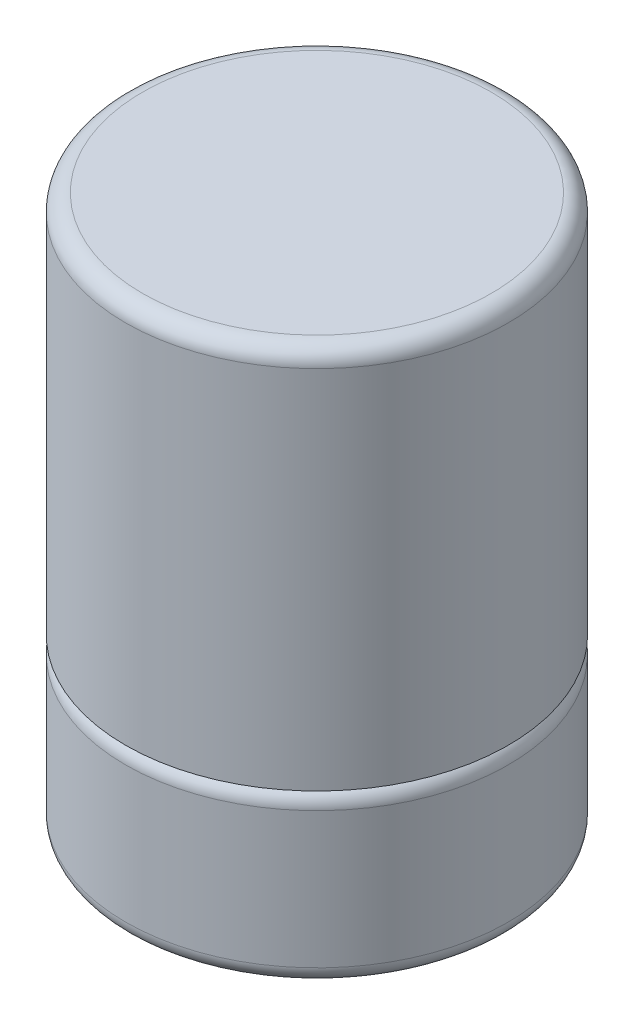
from build123d import *

# Parameters (mm, degrees)
SKETCH1_R           = 14.2875
BOSS_EXTRUDE1_DEPTH = 12.7
FILLET1_R           = 1.27
SKETCH3_R           = 14.2875
BOSS_EXTRUDE2_DEPTH = 28.575
FILLET2_R           = 1.27


with BuildPart() as part:
    # Sketch1 → Boss-Extrude1 (new body)
    with BuildSketch(Plane(origin=(0, 0, 0), x_dir=(1, 0, 0), z_dir=(0, 1, 0))):
        Circle(SKETCH1_R)
    extrude(amount=BOSS_EXTRUDE1_DEPTH)

    # Fillet1
    fillet1_edges = [part.edges().sort_by_distance(p)[0] for p in [
        (-14.2875, 0, 0),
        (-14.2875, 12.7, 0),
    ]]
    fillet(fillet1_edges, radius=FILLET1_R)

    # Sketch3 → Boss-Extrude2 (add)
    with BuildSketch(Plane(origin=(0, 12.7, 0), x_dir=(1, 0, 0), z_dir=(0, 1, 0))):
        Circle(SKETCH3_R)
    extrude(amount=BOSS_EXTRUDE2_DEPTH)

    # Fillet2
    fillet2_edges = [part.edges().sort_by_distance(p)[0] for p in [
        (-14.2875, 41.275, 0),
    ]]
    fillet(fillet2_edges, radius=FILLET2_R)


solid = part.part
